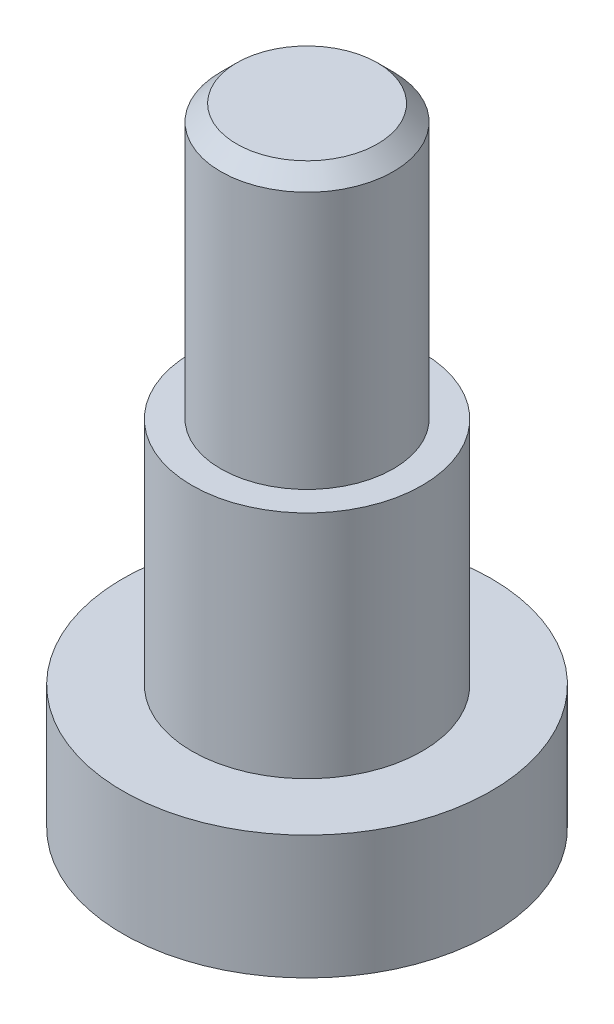
from build123d import *

# Parameters (mm, degrees)
SKETCH_1_R          = 6.4
EXTRUDE_1_DEPTH     = 4.3
SKETCH_2_R          = 4
EXTRUDE_2_DEPTH     = 8
SKETCH_3_R          = 3
EXTRUDE_3_DEPTH     = 9.5
CUT_EXTRUDE_1_DEPTH = 2


# Read off the part's stored shape, not the designer's step: M6x1.0 机械螺纹 螺柱1
with BuildPart() as part:
    # 草图1 → 凸台-拉伸1 (new body)
    with BuildSketch(Plane(origin=(0, 0, 0), x_dir=(1, 0, 0), z_dir=(0, 1, 0))):
        with Locations(Location((0, 0, 0), (0, 0, 90))):
            Circle(SKETCH_1_R)
    extrude(amount=EXTRUDE_1_DEPTH)

    # 草图2 → 凸台-拉伸2 (add)
    with BuildSketch(Plane(origin=(0, 4.3, 0), x_dir=(1, 0, 0), z_dir=(0, 1, 0))):
        with Locations(Location((0, 0, 0), (0, 0, 270))):
            Circle(SKETCH_2_R)
    extrude(amount=EXTRUDE_2_DEPTH)

    # 草图3 → 凸台-拉伸3 (add)
    with BuildSketch(Plane(origin=(0, 12.3, 0), x_dir=(1, 0, 0), z_dir=(0, 1, 0))):
        with Locations(Location((0, 0, 0), (0, 0, 270))):
            Circle(SKETCH_3_R)
    extrude(amount=EXTRUDE_3_DEPTH)

    # M6x1.0 机械螺纹 螺柱1 outline → M6x1.0 机械螺纹 螺柱1 (revolve, cut)
    with BuildSketch(Plane.XY):
        Polygon((3, 21.8), (2.4455, 21.8), (3, 21.2455), align=None)
    revolve(axis=Axis((0, 0, 0), (0, 1, 0)), mode=Mode.SUBTRACT)

    # 草图5 → 切除-拉伸1 (cut)
    with BuildSketch(Plane.XZ):
        Polygon((1.847520861, 0), (0.923760431, 1.6), (-0.923760431, 1.6), (-1.847520861, 0), (-0.923760431, -1.6), (0.923760431, -1.6), align=None)
    extrude(amount=-CUT_EXTRUDE_1_DEPTH, mode=Mode.SUBTRACT)


solid = part.part
